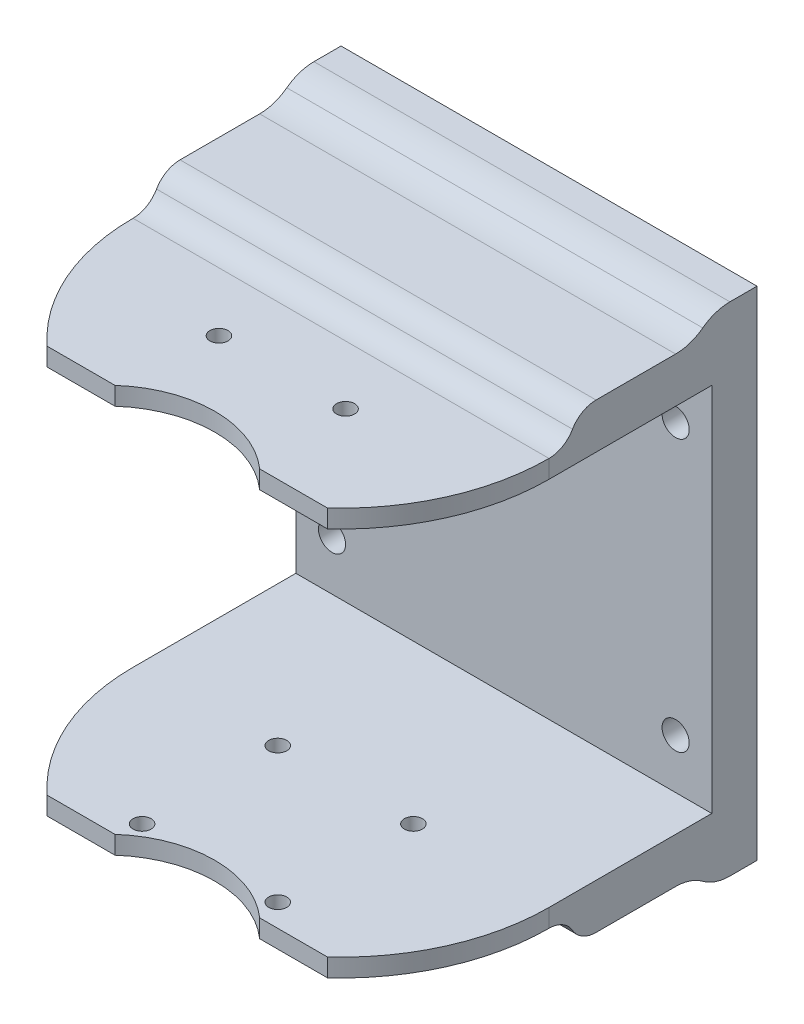
from build123d import *

# Parameters (mm, degrees)
SKETCH_1_W          = 46
SKETCH_1_H          = 40
SKETCH_1_R          = 1.5
EXTRUDE_1_DEPTH     = 5
SKETCH_2_W          = 46
SKETCH_2_H          = 7.5
EXTRUDE_2_DEPTH     = 5
SKETCH_3_W          = 46
SKETCH_3_H          = 5
EXTRUDE_3_DEPTH     = 15
FILLET_1_R          = 5
FILLET_2_R          = 5
SKETCH_4_W          = 46
SKETCH_4_H          = 2
EXTRUDE_4_DEPTH     = 20
SKETCH_5_R          = 1
CUT_EXTRUDE_1_DEPTH = 2
SKETCH_6_R          = 1
CUT_EXTRUDE_2_DEPTH = 2
FILLET_3_R          = 3
FILLET_4_R          = 3
CUT_EXTRUDE_3_REACH = 70.037


with BuildPart() as part:
    # 草图1 → 凸台-拉伸1 (new body)
    with BuildSketch(Plane.XY):
        Rectangle(SKETCH_1_W, SKETCH_1_H)
        with Locations((-19, 15)):
            Circle(SKETCH_1_R, mode=Mode.SUBTRACT)
        with Locations(Location((19, 15, 0), (0, 0, 180))):
            Circle(SKETCH_1_R, mode=Mode.SUBTRACT)
        with Locations((19, -15)):
            Circle(SKETCH_1_R, mode=Mode.SUBTRACT)
        with Locations(Location((-19, -15, 0), (0, 0, 180))):
            Circle(SKETCH_1_R, mode=Mode.SUBTRACT)
    extrude(amount=EXTRUDE_1_DEPTH)

    # 草图2 → 凸台-拉伸2 (add)
    with BuildSketch(Plane.XY.offset(5)):
        with Locations((0, -23.75)):
            Rectangle(SKETCH_2_W, SKETCH_2_H)
        with Locations((0, 23.75)):
            Rectangle(SKETCH_2_W, SKETCH_2_H)
    extrude(amount=-EXTRUDE_2_DEPTH)

    # 草图3 → 凸台-拉伸3 (add)
    with BuildSketch(Plane.XY.offset(5)):
        with Locations((0, -23)):
            Rectangle(SKETCH_3_W, SKETCH_3_H)
        with Locations((0, 23)):
            Rectangle(SKETCH_3_W, SKETCH_3_H)
    extrude(amount=EXTRUDE_3_DEPTH)

    # 圆角1
    # the kernel refuses this fillet: 5 mm, written as the material it adds along each edge
    with BuildSketch(Plane(origin=(23, -25.5, 5), x_dir=(0, -1, 0), z_dir=(-1, 0, 0)), Plane(origin=(-23, 25.5, 5), x_dir=(0, 1, 0), z_dir=(1, 0, 0))) as fillet_1_piece_1:
        with BuildLine():
            CenterArc((5, 4), FILLET_1_R, 180, 53.130102354)
            Line((0, 4), (-0.1, 4))
            Line((-0.1, 4), (-0.1, 0))
            Line((-0.1, 0), (0, -0.1))
            ThreePointArc((0, -0.1), (1, -0.1), (1.94, -0.08))
            Line((1.94, -0.08), (2, 0))
        make_face()
    extrude(amount=46)

    # 圆角2
    fillet_2_edges = [part.edges().sort_by_distance(p)[0] for p in [
        (0, 27.5, 5),
        (0, -27.5, 5),
    ]]
    fillet(fillet_2_edges, radius=FILLET_2_R)

    # 草图4 → 凸台-拉伸4 (add)
    with BuildSketch(Plane.XY.offset(20)):
        with Locations((0, 21.5)):
            Rectangle(SKETCH_4_W, SKETCH_4_H)
        with Locations((0, -21.5)):
            Rectangle(SKETCH_4_W, SKETCH_4_H)
    extrude(amount=EXTRUDE_4_DEPTH)

    # 草图5 → 切除-拉伸1 (cut)
    with BuildSketch(Plane.XZ.offset(22.5)):
        with Locations((-7.5, 37.5)):
            Circle(SKETCH_5_R)
        with Locations((7.5, 37.5)):
            Circle(SKETCH_5_R)
        with Locations((-7.5, 22.5)):
            Circle(SKETCH_5_R)
        with Locations((7.5, 22.5)):
            Circle(SKETCH_5_R)
    extrude(amount=-CUT_EXTRUDE_1_DEPTH, mode=Mode.SUBTRACT)

    # 草图6 → 切除-拉伸2 (cut)
    with BuildSketch(Plane.XZ.offset(-20.5)):
        with Locations((7, 29.5)):
            Circle(SKETCH_6_R)
        with Locations(Location((-7, 29.5, 0), (0, 0, 180))):
            Circle(SKETCH_6_R)
    extrude(amount=-CUT_EXTRUDE_2_DEPTH, mode=Mode.SUBTRACT)

    # 圆角3
    # the kernel refuses this fillet: 3 mm, written as the material it adds along each edge
    with BuildSketch(Plane(origin=(-23, -22.5, 20), x_dir=(0, 0, 1), z_dir=(1, 0, 0))) as fillet_3_piece_1_section:
        with BuildLine():
            CenterArc((FILLET_3_R, FILLET_3_R), FILLET_3_R, 180, 90)
            Line((0, FILLET_3_R), (0, 0))
            Line((0, 0), (FILLET_3_R, 0))
        make_face()
    fillet_3_piece_1 = extrude(amount=46, mode=Mode.PRIVATE)
    fillet_3_piece_1 = fillet_3_piece_1 - Plane(origin=(-7.5, -23.184161647, 22.5), x_dir=(1, 0, 0), z_dir=(0, -1, 0)) * Cylinder(1, 104, mode=Mode.PRIVATE)
    fillet_3_piece_1 = fillet_3_piece_1 - Plane(origin=(7.5, -23.184161647, 22.5), x_dir=(1, 0, 0), z_dir=(0, -1, 0)) * Cylinder(1, 104, mode=Mode.PRIVATE)
    add(fillet_3_piece_1)
    with BuildSketch(Plane(origin=(23, 22.5, 20), x_dir=(0, 1, 0), z_dir=(-1, 0, 0))) as fillet_3_piece_2:
        with BuildLine():
            CenterArc((FILLET_3_R, -FILLET_3_R), FILLET_3_R, 90, 90)
            Line((0, -FILLET_3_R), (0, 0))
            Line((0, 0), (FILLET_3_R, 0))
        make_face()
    extrude(amount=46)

    # 圆角4
    fillet_4_edges = [part.edges().sort_by_distance(p)[0] for p in [
        (0, 25.5, 20),
        (0, -25.5, 20),
    ]]
    fillet(fillet_4_edges, radius=FILLET_4_R)

    # 切除-拉伸3: up to this face of the body (flat: up to its plane)
    cut_extrude_3_end = Plane(part.part.faces().sort_by_distance((0, 22.5, 31.516199688))[0])
    # 草图7 → 切除-拉伸3 (cut, up to the picked face)
    with BuildSketch(Plane.XZ.offset(22.5), mode=Mode.PRIVATE) as cut_extrude_3_sk1:
        with BuildLine():
            Line((-8, 40), (8, 40))
            ThreePointArc((8, 40), (0, 36.958405421), (-8, 40))
        make_face()
    cut_extrude_3_tool1 = split(extrude(cut_extrude_3_sk1.sketch, amount=-CUT_EXTRUDE_3_REACH, mode=Mode.PRIVATE), bisect_by=cut_extrude_3_end, keep=Keep.BOTH, mode=Mode.PRIVATE)
    # 草图7 → 切除-拉伸3 (cut, up to the picked face)
    with BuildSketch(Plane.XZ.offset(22.5), mode=Mode.PRIVATE) as cut_extrude_3_sk2:
        with BuildLine():
            Line((-23, 23), (-23, 40))
            Line((-23, 40), (-15.491933385, 40))
            ThreePointArc((-15.491933385, 40), (-21.03942095, 32.292080826), (-23, 23))
        make_face()
    cut_extrude_3_tool2 = split(extrude(cut_extrude_3_sk2.sketch, amount=-CUT_EXTRUDE_3_REACH, mode=Mode.PRIVATE), bisect_by=cut_extrude_3_end, keep=Keep.BOTH, mode=Mode.PRIVATE)
    # 草图7 → 切除-拉伸3 (cut, up to the picked face)
    with BuildSketch(Plane.XZ.offset(22.5), mode=Mode.PRIVATE) as cut_extrude_3_sk3:
        with BuildLine():
            Line((23, 23), (23, 40))
            Line((23, 40), (15.491933385, 40))
            ThreePointArc((15.491933385, 40), (21.03942095, 32.292080826), (23, 23))
        make_face()
    cut_extrude_3_tool3 = split(extrude(cut_extrude_3_sk3.sketch, amount=-CUT_EXTRUDE_3_REACH, mode=Mode.PRIVATE), bisect_by=cut_extrude_3_end, keep=Keep.BOTH, mode=Mode.PRIVATE)
    add(cut_extrude_3_tool1.solids().sort_by(Axis((0, -22.5, 38.769148), (0, 1, 0)))[0], mode=Mode.SUBTRACT)
    add(cut_extrude_3_tool2.solids().sort_by(Axis((-20.828476, -22.5, 35.901225), (0, 1, 0)))[0], mode=Mode.SUBTRACT)
    add(cut_extrude_3_tool3.solids().sort_by(Axis((20.828476, -22.5, 35.901225), (0, 1, 0)))[0], mode=Mode.SUBTRACT)


solid = part.part
